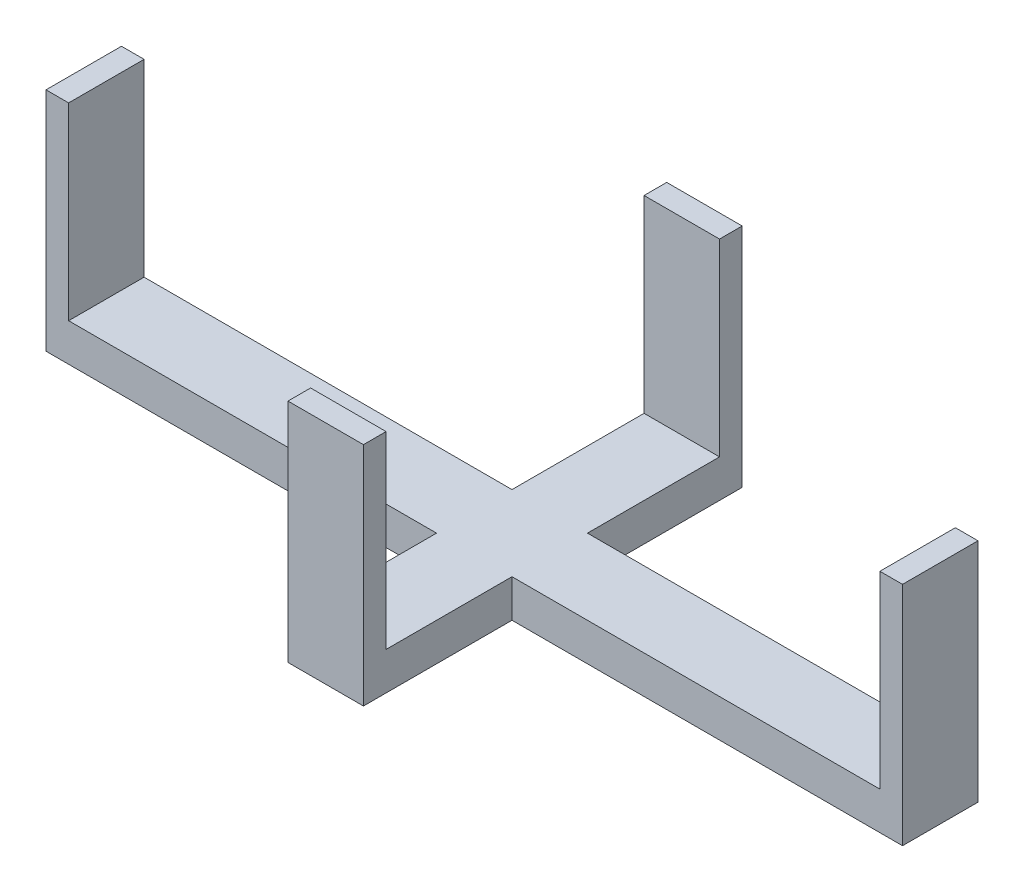
from build123d import *

# Parameters (mm, degrees)
BOSS_EXTRUDE1_DEPTH = 5
SKETCH2_W           = 10
SKETCH2_H           = 3
BOSS_EXTRUDE2_DEPTH = 25
BOSS_EXTRUDE3_DEPTH = 25
SKETCH4_W           = 3
SKETCH4_H           = 10
BOSS_EXTRUDE4_DEPTH = 25
SKETCH5_W           = 3
SKETCH5_H           = 10
BOSS_EXTRUDE5_DEPTH = 25
SKETCH6_W           = 3
SKETCH6_H           = 10
BOSS_EXTRUDE6_DEPTH = 5
SKETCH7_W           = 3
SKETCH7_H           = 10
BOSS_EXTRUDE7_DEPTH = 5
SKETCH8_W           = 10
SKETCH8_H           = 3
BOSS_EXTRUDE8_DEPTH = 5
SKETCH9_W           = 10
SKETCH9_H           = 3
BOSS_EXTRUDE9_DEPTH = 5


with BuildPart() as part:
    # Sketch1 → Boss-Extrude1 (new body)
    with BuildSketch(Plane(origin=(0, 0, 0), x_dir=(1, 0, 0), z_dir=(0, 1, 0))):
        Polygon((0, 10), (0, 0), (48.75, 0), (48.75, -16.68539211), (58.75, -16.68539211), (58.75, 0), (107.5, 0), (107.5, 10), (58.75, 10), (58.75, 27.5), (48.75, 27.5), (48.75, 10), align=None)
    extrude(amount=BOSS_EXTRUDE1_DEPTH)



with BuildPart() as body_2:
    # Sketch2 → Boss-Extrude2 (new body)
    with BuildSketch(Plane(origin=(0, 5, 0), x_dir=(1, 0, 0), z_dir=(0, 1, 0))):
        with Locations((53.75, -18.18539211)):
            Rectangle(SKETCH2_W, SKETCH2_H)
    extrude(amount=BOSS_EXTRUDE2_DEPTH)


with BuildPart() as body_3:
    # Sketch3 → Boss-Extrude3 (new body)
    with BuildSketch(Plane(origin=(0, 5, 0), x_dir=(1, 0, 0), z_dir=(0, 1, 0))):
        Polygon((48.75, 30.5), (48.75, 27.5), (58.75, 27.5), (58.75, 30.5), (57.553261147, 30.5), align=None)
    extrude(amount=BOSS_EXTRUDE3_DEPTH)


with BuildPart() as body_4:
    # Sketch4 → Boss-Extrude4 (new body)
    with BuildSketch(Plane(origin=(0, 5, 0), x_dir=(1, 0, 0), z_dir=(0, 1, 0))):
        with Locations((109, 5)):
            Rectangle(SKETCH4_W, SKETCH4_H)
    extrude(amount=BOSS_EXTRUDE4_DEPTH)


with BuildPart() as body_5:
    # Sketch5 → Boss-Extrude5 (new body)
    with BuildSketch(Plane(origin=(0, 5, 0), x_dir=(1, 0, 0), z_dir=(0, 1, 0))):
        with Locations((-1.5, 5)):
            Rectangle(SKETCH5_W, SKETCH5_H)
    extrude(amount=BOSS_EXTRUDE5_DEPTH)


with BuildPart() as part_1:
    add(part.part)

    add(body_5.part)  # Boss-Extrude6 merges body 5
    # Sketch6 → Boss-Extrude6 (add)
    with BuildSketch(Plane.XZ.offset(-5)):
        with Locations((-1.5, -5)):
            Rectangle(SKETCH6_W, SKETCH6_H)
    extrude(amount=BOSS_EXTRUDE6_DEPTH)


    add(body_4.part)  # Boss-Extrude7 merges body 4
    # Sketch7 → Boss-Extrude7 (add)
    with BuildSketch(Plane(origin=(0, 5, 0), x_dir=(-1, 0, 0), z_dir=(0, -1, 0))):
        with Locations((-109, 5)):
            Rectangle(SKETCH7_W, SKETCH7_H)
    extrude(amount=BOSS_EXTRUDE7_DEPTH)


    add(body_2.part)  # Boss-Extrude8 merges body 2
    # Sketch8 → Boss-Extrude8 (add)
    with BuildSketch(Plane(origin=(0, 5, 0), x_dir=(-1, 0, 0), z_dir=(0, -1, 0))):
        with Locations((-53.75, -18.18539211)):
            Rectangle(SKETCH8_W, SKETCH8_H)
    extrude(amount=BOSS_EXTRUDE8_DEPTH)


    add(body_3.part)  # Boss-Extrude9 merges body 3
    # Sketch9 → Boss-Extrude9 (add)
    with BuildSketch(Plane.XZ.offset(-5)):
        with Locations((53.75, -29)):
            Rectangle(SKETCH9_W, SKETCH9_H)
    extrude(amount=BOSS_EXTRUDE9_DEPTH)


solid = part_1.part
